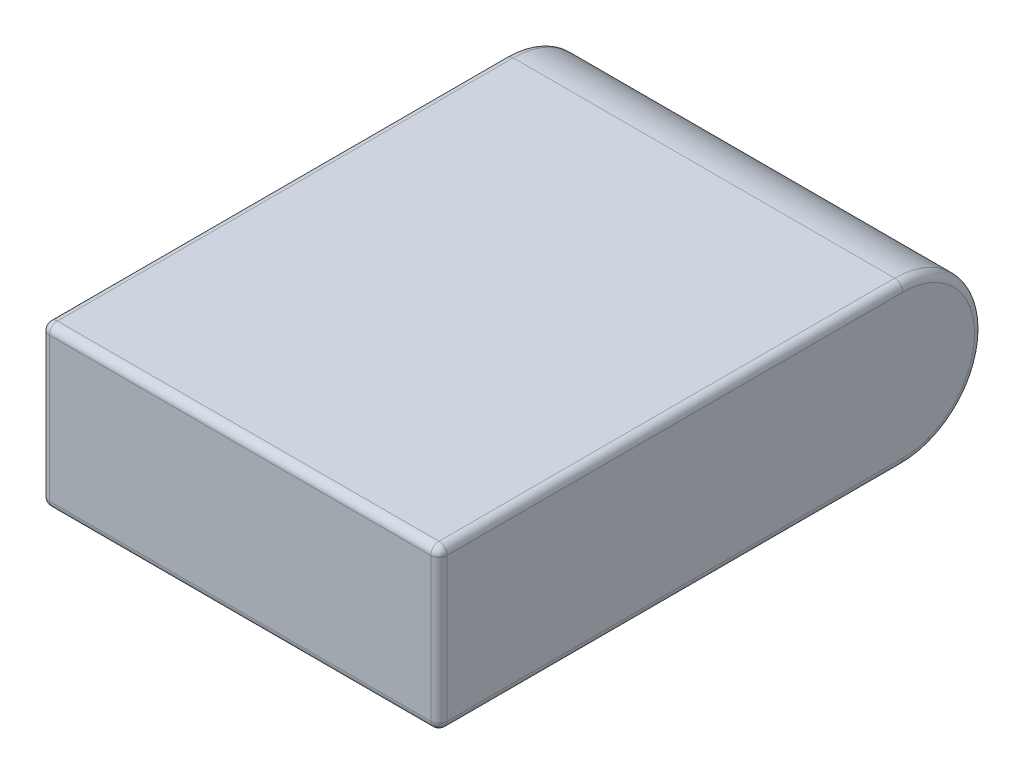
from build123d import *

# Parameters (mm, degrees)
SKETCH1_W           = 49
SKETCH1_H           = 67
BOSS_EXTRUDE1_DEPTH = 19.7
FILLET3_R           = 9.85
FILLET4_R           = 1


with BuildPart() as part:
    # Sketch1 → Boss-Extrude1 (new body)
    with BuildSketch(Plane(origin=(0, 0, 0), x_dir=(1, 0, 0), z_dir=(0, 1, 0))):
        Rectangle(SKETCH1_W, SKETCH1_H)
    extrude(amount=-BOSS_EXTRUDE1_DEPTH)

    # Fillet3
    fillet3_edges = [part.edges().sort_by_distance(p)[0] for p in [
        (0, -19.7, -33.5),
        (0, 0, -33.5),
    ]]
    fillet(fillet3_edges, radius=FILLET3_R - 0.0001)  # a hair under: the kernel refuses the full size

    # Fillet4
    fillet4_edges = [part.edges().sort_by_distance(p)[0] for p in [
        (0, -19.7, 33.5),
        (-24.5, 0, 4.92495),
        (-24.5, -19.7, 4.92495),
        (-24.5, -2.884968916, -30.615031084),
        (-24.5, -16.815031084, -30.615031084),
        (24.5, -2.884968916, -30.615031084),
        (24.5, -16.815031084, -30.615031084),
        (24.5, -19.7, 4.92495),
        (0, 0, 33.5),
        (24.5, 0, 4.92495),
        (24.5, -9.85, 33.5),
        (-24.5, -9.85, 33.5),
    ]]
    fillet(fillet4_edges, radius=FILLET4_R)


solid = part.part
